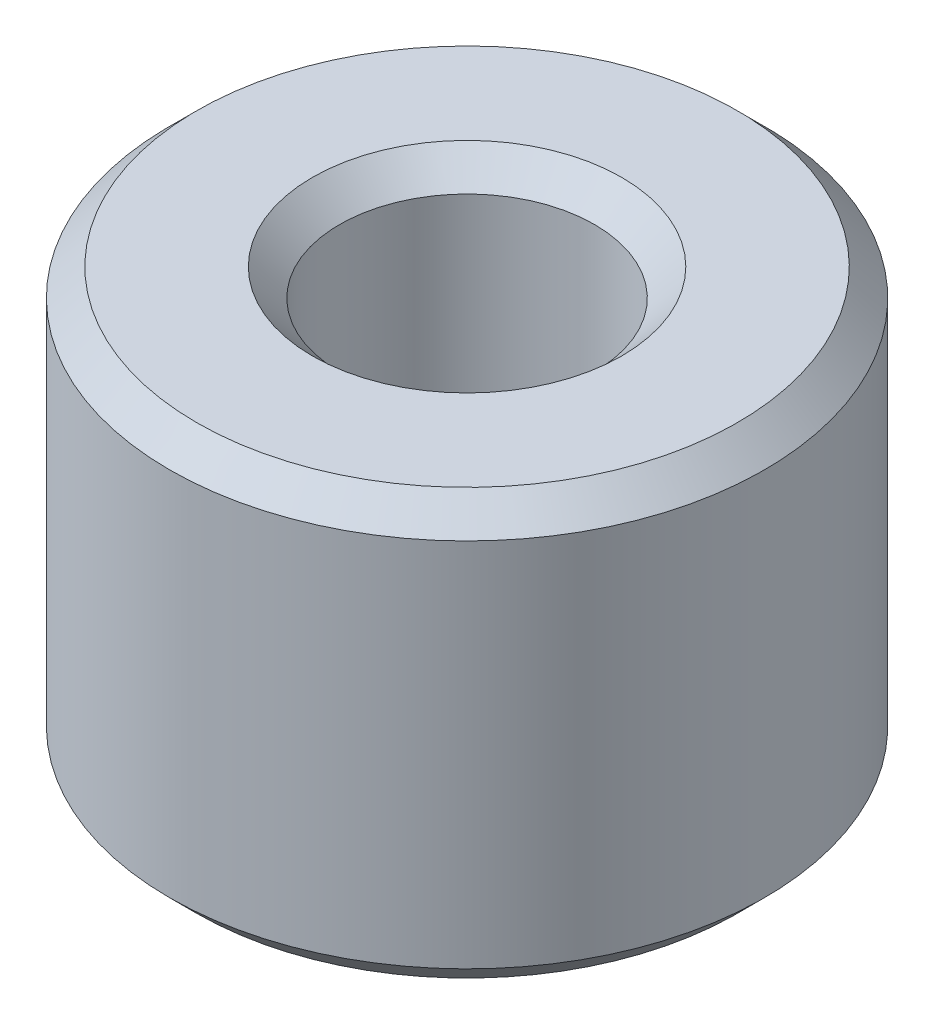
from build123d import *

# Parameters (mm, degrees)
SKETCH1_R           = 5.55625
SKETCH1_R_2         = 2.38125
BOSS_EXTRUDE1_DEPTH = 7.9375
CHAMFER1_SIZE       = 0.508


with BuildPart() as part:
    # Sketch1 → Boss-Extrude1 (new body)
    with BuildSketch(Plane(origin=(0, 0, 0), x_dir=(1, 0, 0), z_dir=(0, 1, 0))):
        Circle(SKETCH1_R)
        Circle(SKETCH1_R_2, mode=Mode.SUBTRACT)
    extrude(amount=BOSS_EXTRUDE1_DEPTH)

    # Chamfer1
    chamfer1_edges = [part.edges().sort_by_distance(p)[0] for p in [
        (-2.38125, 0, 0),
        (-5.55625, 0, 0),
        (-2.38125, 7.9375, 0),
        (-5.55625, 7.9375, 0),
    ]]
    chamfer(chamfer1_edges, length=CHAMFER1_SIZE)


solid = part.part
